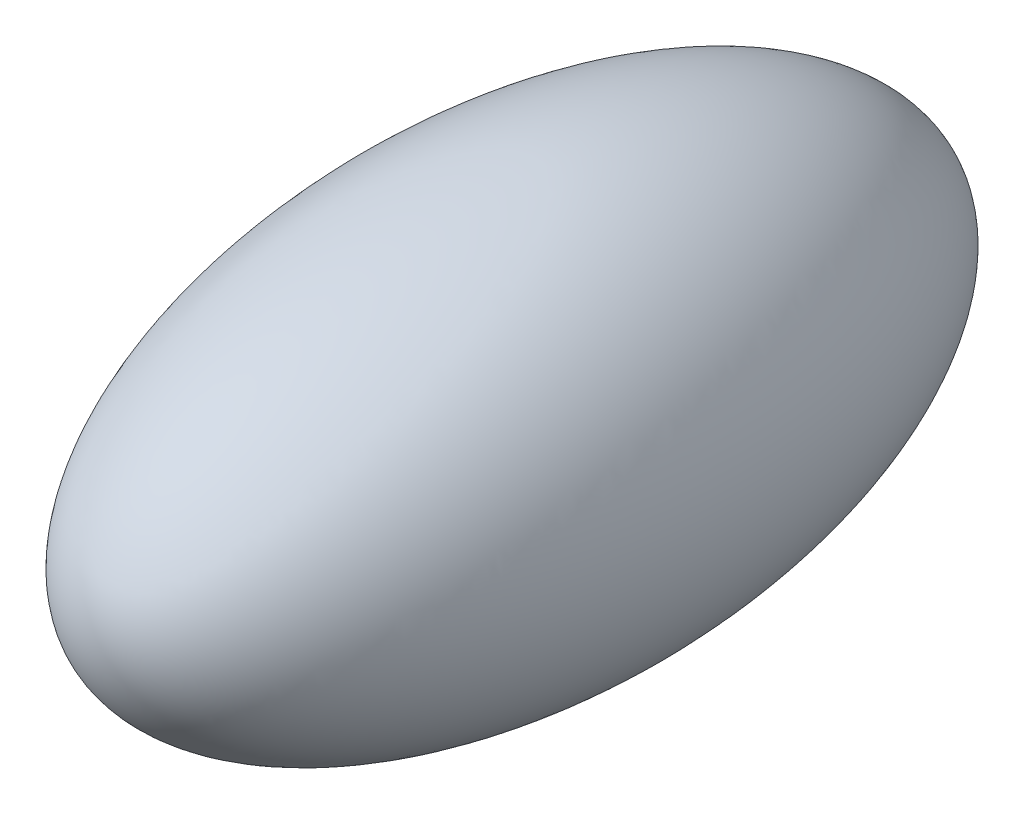
from build123d import *


with BuildPart() as part:
    # Sketch1 → Revolve5 (revolve)
    with BuildSketch(Plane(origin=(0, 0, 0), x_dir=(1, 0, 0), z_dir=(0, 1, 0))):
        with BuildLine():
            Line((0, 100), (0, -100))
            add(Edge.make_bspline(
                [(0, -100), (50, -100), (50, 0), (50, 100), (0, 100)],
                knots=[3.141592654, 3.141592654, 3.141592654, 4.71238898, 4.71238898, 6.283185307, 6.283185307, 6.283185307], degree=2, weights=[1, 0.707106781, 1, 0.707106781, 1]))
        make_face()
    revolve(axis=Axis((0, 0, -100), (0, 0, -1)))


solid = part.part
